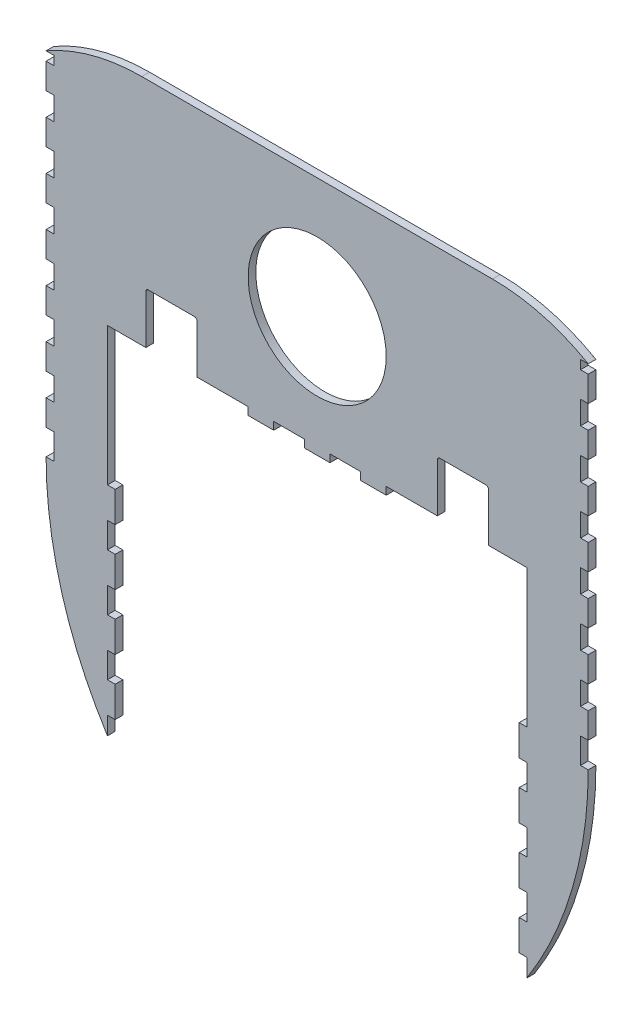
from build123d import *

# Parameters (mm, degrees)
SKETCH1_R           = 27
BOSS_EXTRUDE1_DEPTH = 3


with BuildPart() as part:
    # Sketch1 → Boss-Extrude1 (new body)
    with BuildSketch(Plane.XY):
        with BuildLine():
            Line((-82, 47.240801847), (-82, 59.240801847))
            Line((-82, 59.240801847), (-82, 69.240801847))
            Line((-82, 69.240801847), (-71, 69.240801847))
            Line((-71, 69.240801847), (-67, 69.240801847))
            Line((-67, 69.240801847), (-67, 88.240801847))
            ThreePointArc((-67, 88.240801847), (-66.707106781, 88.947908628), (-66, 89.240801847))
            Line((-66, 89.240801847), (-48, 89.240801847))
            ThreePointArc((-48, 89.240801847), (-47.292893219, 88.947908628), (-47, 88.240801847))
            Line((-47, 88.240801847), (-47, 69.240801847))
            Line((-47, 69.240801847), (-39, 69.240801847))
            Line((-39, 69.240801847), (-27, 69.240801847))
            Line((-27, 69.240801847), (-27, 66.240801847))
            Line((-27, 66.240801847), (-17, 66.240801847))
            Line((-17, 66.240801847), (-17, 69.240801847))
            Line((-17, 69.240801847), (-5, 69.240801847))
            Line((-5, 69.240801847), (-5, 66.240801847))
            Line((-5, 66.240801847), (5, 66.240801847))
            Line((5, 66.240801847), (5, 69.240801847))
            Line((5, 69.240801847), (17, 69.240801847))
            Line((17, 69.240801847), (17, 66.240801847))
            Line((17, 66.240801847), (27, 66.240801847))
            Line((27, 66.240801847), (27, 69.240801847))
            Line((27, 69.240801847), (39, 69.240801847))
            Line((39, 69.240801847), (47, 69.240801847))
            Line((47, 69.240801847), (47, 88.240801847))
            ThreePointArc((47, 88.240801847), (47.292893219, 88.947908628), (48, 89.240801847))
            Line((48, 89.240801847), (66, 89.240801847))
            ThreePointArc((66, 89.240801847), (66.707106781, 88.947908628), (67, 88.240801847))
            Line((67, 88.240801847), (67, 69.240801847))
            Line((67, 69.240801847), (71, 69.240801847))
            Line((71, 69.240801847), (82, 69.240801847))
            Line((82, 69.240801847), (82, 59.240801847))
            Line((82, 59.240801847), (82, 47.240801847))
            Line((82, 47.240801847), (82, 37.240801847))
            Line((82, 37.240801847), (82, 25.240801847))
            Line((82, 25.240801847), (82, 15.240801847))
            Line((82, 15.240801847), (79, 15.240801847))
            Line((79, 15.240801847), (79, 3.240801847))
            Line((79, 3.240801847), (82, 3.240801847))
            Line((82, 3.240801847), (82, -6.759198153))
            Line((82, -6.759198153), (79, -6.759198153))
            Line((79, -6.759198153), (79, -18.759198153))
            Line((79, -18.759198153), (82, -18.759198153))
            Line((82, -18.759198153), (82, -28.759198153))
            Line((82, -28.759198153), (79, -28.759198153))
            Line((79, -28.759198153), (79, -40.759198153))
            Line((79, -40.759198153), (82, -40.759198153))
            Line((82, -40.759198153), (82, -50.759198153))
            Line((82, -50.759198153), (79, -50.759198153))
            Line((79, -50.759198153), (79, -62.759198153))
            Line((79, -62.759198153), (82, -62.759198153))
            Line((82, -62.759198153), (82, -69.759198153))
            ThreePointArc((82, -69.759198153), (99.878161007, -30.219208628), (106, 12.740801847))
            Line((106, 12.740801847), (103, 12.740801847))
            Line((103, 12.740801847), (103, 22.740801847))
            Line((103, 22.740801847), (106, 22.740801847))
            Line((106, 22.740801847), (106, 32.740801847))
            Line((106, 32.740801847), (103, 32.740801847))
            Line((103, 32.740801847), (103, 41.740801847))
            Line((103, 41.740801847), (106, 41.740801847))
            Line((106, 41.740801847), (106, 51.740801847))
            Line((106, 51.740801847), (103, 51.740801847))
            Line((103, 51.740801847), (103, 60.740801847))
            Line((103, 60.740801847), (106, 60.740801847))
            Line((106, 60.740801847), (106, 70.740801847))
            Line((106, 70.740801847), (103, 70.740801847))
            Line((103, 70.740801847), (103, 79.740801847))
            Line((103, 79.740801847), (106, 79.740801847))
            Line((106, 79.740801847), (106, 89.740801847))
            Line((106, 89.740801847), (103, 89.740801847))
            Line((103, 89.740801847), (103, 98.740801847))
            Line((103, 98.740801847), (106, 98.740801847))
            Line((106, 98.740801847), (106, 108.740801847))
            Line((106, 108.740801847), (103, 108.740801847))
            Line((103, 108.740801847), (103, 117.740801847))
            Line((103, 117.740801847), (106, 117.740801847))
            Line((106, 117.740801847), (106, 127.740801847))
            Line((106, 127.740801847), (103, 127.740801847))
            Line((103, 127.740801847), (103, 136.740801847))
            Line((103, 136.740801847), (106, 136.740801847))
            Line((106, 136.740801847), (106, 146.740801847))
            Line((106, 146.740801847), (103, 146.740801847))
            Line((103, 146.740801847), (103, 150.240801847))
            Line((103, 150.240801847), (106, 150.240801847))
            ThreePointArc((106, 150.240801847), (87.948342863, 157.697685577), (68.583426132, 160.240801847))
            Line((68.583426132, 160.240801847), (-68.583426132, 160.240801847))
            ThreePointArc((-68.583426132, 160.240801847), (-87.948342863, 157.697685577), (-106, 150.240801847))
            Line((-106, 150.240801847), (-103, 150.240801847))
            Line((-103, 150.240801847), (-103, 146.740801847))
            Line((-103, 146.740801847), (-106, 146.740801847))
            Line((-106, 146.740801847), (-106, 136.740801847))
            Line((-106, 136.740801847), (-103, 136.740801847))
            Line((-103, 136.740801847), (-103, 127.740801847))
            Line((-103, 127.740801847), (-106, 127.740801847))
            Line((-106, 127.740801847), (-106, 117.740801847))
            Line((-106, 117.740801847), (-103, 117.740801847))
            Line((-103, 117.740801847), (-103, 108.740801847))
            Line((-103, 108.740801847), (-106, 108.740801847))
            Line((-106, 108.740801847), (-106, 98.740801847))
            Line((-106, 98.740801847), (-103, 98.740801847))
            Line((-103, 98.740801847), (-103, 89.740801847))
            Line((-103, 89.740801847), (-106, 89.740801847))
            Line((-106, 89.740801847), (-106, 79.740801847))
            Line((-106, 79.740801847), (-103, 79.740801847))
            Line((-103, 79.740801847), (-103, 70.740801847))
            Line((-103, 70.740801847), (-106, 70.740801847))
            Line((-106, 70.740801847), (-106, 60.740801847))
            Line((-106, 60.740801847), (-103, 60.740801847))
            Line((-103, 60.740801847), (-103, 51.740801847))
            Line((-103, 51.740801847), (-106, 51.740801847))
            Line((-106, 51.740801847), (-106, 41.740801847))
            Line((-106, 41.740801847), (-103, 41.740801847))
            Line((-103, 41.740801847), (-103, 32.740801847))
            Line((-103, 32.740801847), (-106, 32.740801847))
            Line((-106, 32.740801847), (-106, 22.740801847))
            Line((-106, 22.740801847), (-103, 22.740801847))
            Line((-103, 22.740801847), (-103, 12.740801847))
            Line((-103, 12.740801847), (-106, 12.740801847))
            ThreePointArc((-106, 12.740801847), (-99.878161007, -30.219208628), (-82, -69.759198153))
            Line((-82, -69.759198153), (-82, -62.759198153))
            Line((-82, -62.759198153), (-79, -62.759198153))
            Line((-79, -62.759198153), (-79, -50.759198153))
            Line((-79, -50.759198153), (-82, -50.759198153))
            Line((-82, -50.759198153), (-82, -40.759198153))
            Line((-82, -40.759198153), (-79, -40.759198153))
            Line((-79, -40.759198153), (-79, -28.759198153))
            Line((-79, -28.759198153), (-82, -28.759198153))
            Line((-82, -28.759198153), (-82, -18.759198153))
            Line((-82, -18.759198153), (-79, -18.759198153))
            Line((-79, -18.759198153), (-79, -6.759198153))
            Line((-79, -6.759198153), (-82, -6.759198153))
            Line((-82, -6.759198153), (-82, 3.240801847))
            Line((-82, 3.240801847), (-79, 3.240801847))
            Line((-79, 3.240801847), (-79, 15.240801847))
            Line((-79, 15.240801847), (-82, 15.240801847))
            Line((-82, 15.240801847), (-82, 25.240801847))
            Line((-82, 25.240801847), (-82, 37.240801847))
            Line((-82, 37.240801847), (-82, 47.240801847))
        make_face()
        with Locations((0, 113.240801847)):
            Circle(SKETCH1_R, mode=Mode.SUBTRACT)
    extrude(amount=BOSS_EXTRUDE1_DEPTH)


solid = part.part
